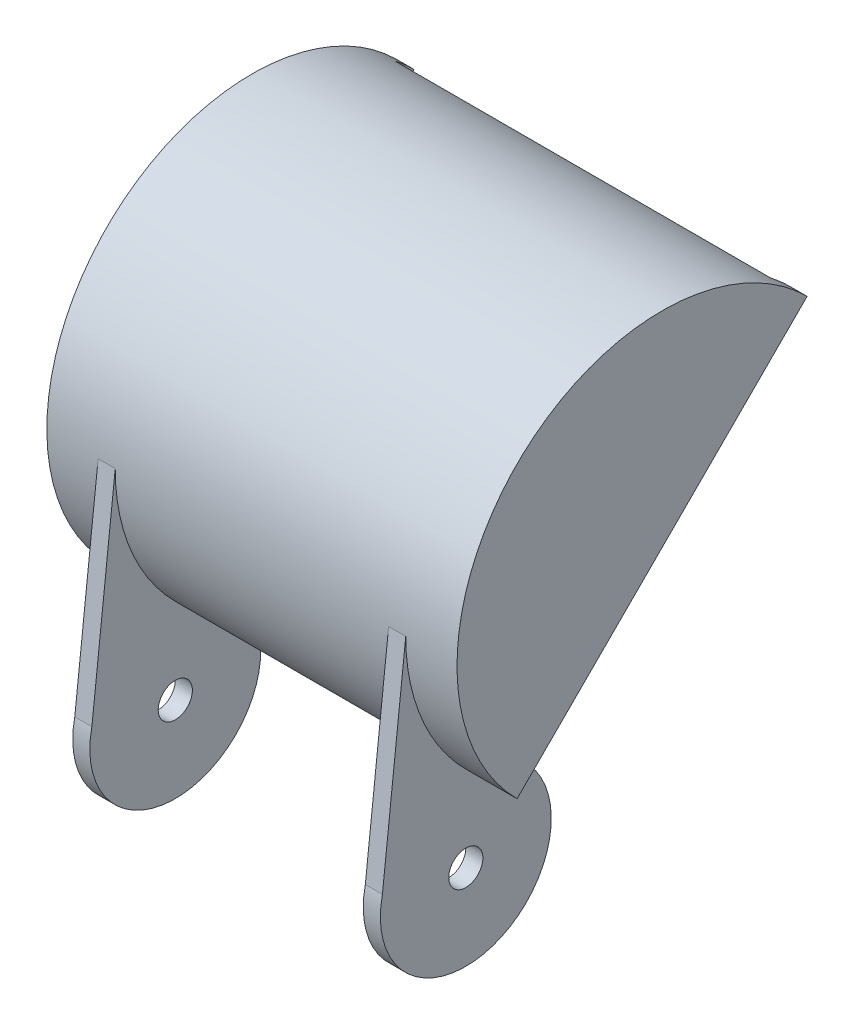
from build123d import *

# Parameters (mm, degrees)
BOSS_EXTRUDE1_DEPTH = 38.1
SHELL1_T            = -3.175
SKETCH4_R           = 15.875
BOSS_EXTRUDE3_DEPTH = 28.575
BOSS_EXTRUDE4_DEPTH = 28.575
SKETCH6_R           = 15.875
CUT_EXTRUDE2_DEPTH  = 25.4
CUT_EXTRUDE3_START  = 25.4
SKETCH6_2_R         = 15.875
CUT_EXTRUDE3_DEPTH  = 25.4
CUT_EXTRUDE4_REACH  = 109.606
SKETCH7_R           = 3.175
BOSS_EXTRUDE5_REACH = 109.606
CUT_EXTRUDE5_DEPTH  = 25.4


with BuildPart() as part:
    # Sketch2 → Boss-Extrude1 (new, symmetric)
    with BuildSketch(Plane(origin=(0, 0, 0), x_dir=(0, 0, -1), z_dir=(1, 0, 0))):
        with BuildLine():
            Line((0, 0), (53.881536726, 53.881536726))
            ThreePointArc((53.881536726, 53.881536726), (0, 53.881536726), (0, 0))
        make_face()
    extrude(amount=BOSS_EXTRUDE1_DEPTH, both=True)

    # Shell1
    shell1_openings = [part.faces().sort_by_distance(p)[0] for p in [
        (0, 26.940768363, -26.940768363),
    ]]
    offset(amount=SHELL1_T, openings=shell1_openings)

    # Chamfer1
    # the kernel refuses this chamfer: 10 mm, written as the material it takes off along each edge
    with BuildSketch(Plane(origin=(34.925, 51.636472696, -51.636472696), x_dir=(0, 0.6876558872178, -0.726036762688158), z_dir=(-1, 0, 0))) as chamfer1_piece_1:
        with BuildLine():
            Line((8.869626963, -0.240804851), (-1.086879529, -7.747424349))
            ThreePointArc((-1.086879529, -7.747424349), (-0.345966855, -4.045712731), (0, 0))
            Line((0, 0), (8.869626963, -0.240804851))
        make_face()
    extrude(amount=69.85, mode=Mode.SUBTRACT)



with BuildPart() as body_2:
    # Sketch4 → Boss-Extrude3 (new, symmetric)
    with BuildSketch(Plane(origin=(0, 0, 0), x_dir=(0, 0, -1), z_dir=(1, 0, 0))):
        with Locations((0, -15.875)):
            Circle(SKETCH4_R)
    extrude(amount=BOSS_EXTRUDE3_DEPTH, both=True)


with BuildPart() as part_1:
    add(part.part)

    add(body_2.part)  # Boss-Extrude4 merges body 2
    # Sketch5 → Boss-Extrude4 (add, symmetric)
    with BuildSketch(Plane(origin=(0, 0, 0), x_dir=(0, 0, -1), z_dir=(1, 0, 0))):
        Polygon((2.24506403, 2.24506403), (2.24506403, -0.159551788), (0, 0), align=None)
    extrude(amount=BOSS_EXTRUDE4_DEPTH, both=True)

    # Sketch6 → Cut-Extrude2 (cut)
    with BuildSketch(Plane(origin=(0, 0, 0), x_dir=(0, 0, -1), z_dir=(1, 0, 0))):
        with Locations((0, -15.875)):
            Circle(SKETCH6_R)
    extrude(amount=-CUT_EXTRUDE2_DEPTH, mode=Mode.SUBTRACT)

    # Sketch6<2> → Cut-Extrude3 (cut)
    with BuildSketch(Plane(origin=(0, 0, 0), x_dir=(0, 0, -1), z_dir=(1, 0, 0)).offset(CUT_EXTRUDE3_START)):
        with Locations((0, -15.875)):
            Circle(SKETCH6_2_R)
    extrude(amount=-CUT_EXTRUDE3_DEPTH, mode=Mode.SUBTRACT)

    # Cut-Extrude4: up to this face of the body (flat: up to its plane)
    cut_extrude4_end = Plane(part_1.part.faces().sort_by_distance((28.575, -15.819887854, -0.005001009))[0])
    # Sketch7 → Cut-Extrude4 (cut, up to the picked face)
    with BuildSketch(Plane.ZY.offset(28.575), mode=Mode.PRIVATE) as cut_extrude4_sk1:
        with Locations(Location((0, -15.875, 0), (0, 0, 180))):
            Circle(SKETCH7_R)
    cut_extrude4_tool1 = split(extrude(cut_extrude4_sk1.sketch, amount=-CUT_EXTRUDE4_REACH, mode=Mode.PRIVATE), bisect_by=cut_extrude4_end, keep=Keep.BOTH, mode=Mode.PRIVATE)
    add(cut_extrude4_tool1.solids().sort_by(Axis((-28.575, -15.875, 0), (1, 0, 0)))[0], mode=Mode.SUBTRACT)

    # Boss-Extrude5: up to this face of the body (flat: up to its plane)
    boss_extrude5_end = Plane(part_1.part.faces().sort_by_distance((-28.575, 0.79361509, -1.451448941))[0])
    # Sketch8 → Boss-Extrude5 (add, up to the picked face)
    with BuildSketch(Plane(origin=(28.575, 0, 0), x_dir=(0, 0, -1), z_dir=(1, 0, 0)), mode=Mode.PRIVATE) as boss_extrude5_sk1:
        with BuildLine():
            Line((-11.159231637, 26.940768363), (-15.875, -15.875))
            Line((-15.875, -15.875), (2.24506403, 2.24506403))
            ThreePointArc((2.24506403, 2.24506403), (-3.75420071, 10.280201189), (-7.223023717, 19.688807544))
            Line((-7.223023717, 19.688807544), (-11.159231637, 26.940768363))
        make_face()
    boss_extrude5_tool1 = split(extrude(boss_extrude5_sk1.sketch, amount=-BOSS_EXTRUDE5_REACH, mode=Mode.PRIVATE), bisect_by=boss_extrude5_end, keep=Keep.BOTH, mode=Mode.PRIVATE)
    add(boss_extrude5_tool1.solids().sort_by(Axis((28.575, 4.070009, 8.572047), (-1, 0, 0)))[0])

    # Sketch9 → Cut-Extrude5 (cut, symmetric)
    with BuildSketch(Plane(origin=(0, 0, 0), x_dir=(0, 0, -1), z_dir=(1, 0, 0))):
        with BuildLine():
            Line((2.24506403, -0.159551788), (2.24506403, 2.24506403))
            Line((2.24506403, 2.24506403), (0, 0))
            ThreePointArc((0, 0), (-8.259041825, 12.36052959), (-11.159231637, 26.940768363))
            Line((-11.159231637, 26.940768363), (-15.494456387, -12.419939034))
            ThreePointArc((-15.494456387, -12.419939034), (9.025844742, -28.934469809), (2.24506403, -0.159551788))
        make_face()
    extrude(amount=CUT_EXTRUDE5_DEPTH, both=True, mode=Mode.SUBTRACT)


solid = part_1.part
